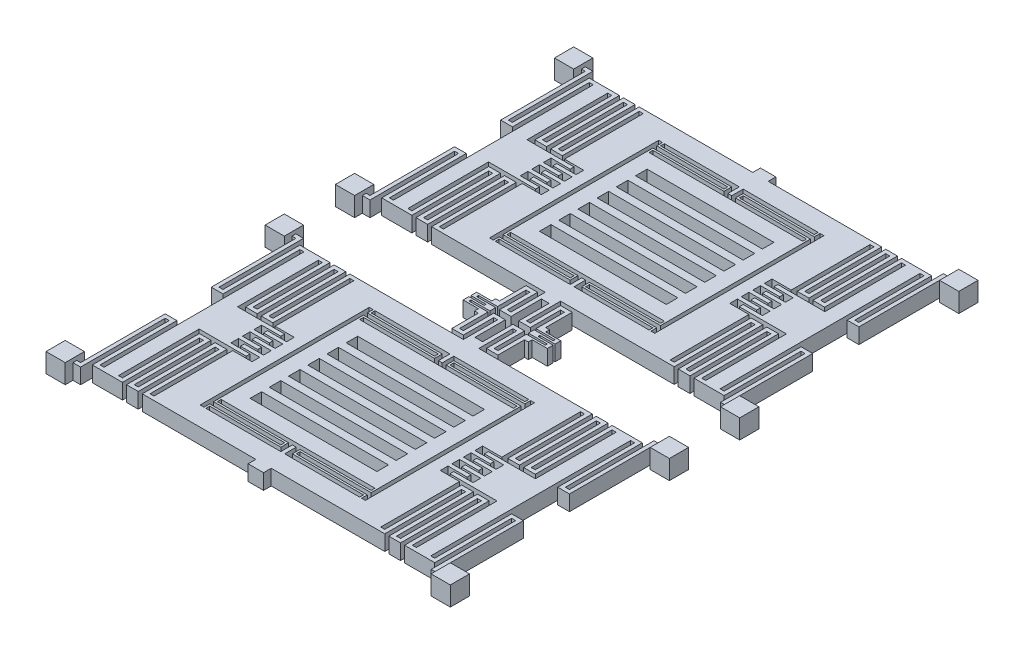
from build123d import *

# Parameters (mm, degrees)
SKETCH1_W           = 0.41
SKETCH1_H           = 0.36
SKETCH1_W_2         = 0.33
SKETCH1_H_2         = 0.03
BOSS_EXTRUDE1_DEPTH = 0.04
BOSS_EXTRUDE2_DEPTH = 0.04
BOSS_EXTRUDE3_DEPTH = 0.04
SKETCH4_W           = 0.05
SKETCH4_H           = 0.05
BOSS_EXTRUDE4_DEPTH = 0.05
BOSS_EXTRUDE5_DEPTH = 0.04


with BuildPart() as part:
    # Sketch1 → Boss-Extrude1 (new body)
    with BuildSketch(Plane(origin=(0, 0, 0), x_dir=(1, 0, 0), z_dir=(0, 1, 0))):
        Rectangle(SKETCH1_W, SKETCH1_H)
        with Locations((0, 0.075)):
            Rectangle(SKETCH1_W_2, SKETCH1_H_2, mode=Mode.SUBTRACT)
        with Locations((0, 0.025)):
            Rectangle(SKETCH1_W_2, SKETCH1_H_2, mode=Mode.SUBTRACT)
        with Locations((0, 0.125)):
            Rectangle(SKETCH1_W_2, SKETCH1_H_2, mode=Mode.SUBTRACT)
        with Locations((0, -0.125)):
            Rectangle(SKETCH1_W_2, SKETCH1_H_2, mode=Mode.SUBTRACT)
        with Locations((0, -0.075)):
            Rectangle(SKETCH1_W_2, SKETCH1_H_2, mode=Mode.SUBTRACT)
        with Locations((0, -0.025)):
            Rectangle(SKETCH1_W_2, SKETCH1_H_2, mode=Mode.SUBTRACT)
    boss_extrude1 = extrude(amount=BOSS_EXTRUDE1_DEPTH)

    # Sketch2 → Boss-Extrude2 (add)
    with BuildSketch(Plane(origin=(0, 0, 0), x_dir=(1, 0, 0), z_dir=(0, 1, 0))):
        Polygon((-0.295, 0.27), (-0.02, 0.27), (-0.02, 0.29), (0.02, 0.29), (0.02, 0.27), (0.295, 0.27), (0.295, 0.055), (0.245, 0.055), (0.245, 0.035), (0.295, 0.035), (0.295, 0.025), (0.245, 0.025), (0.245, 0.005), (0.295, 0.005), (0.295, -0.005), (0.245, -0.005), (0.245, -0.025), (0.295, -0.025), (0.295, -0.035), (0.245, -0.035), (0.245, -0.055), (0.295, -0.055), (0.295, -0.27), (0.02, -0.27), (0.02, -0.29), (-0.02, -0.29), (-0.02, -0.27), (-0.295, -0.27), (-0.295, -0.055), (-0.245, -0.055), (-0.245, -0.035), (-0.295, -0.035), (-0.295, -0.025), (-0.245, -0.025), (-0.245, -0.005), (-0.295, -0.005), (-0.295, 0.005), (-0.245, 0.005), (-0.245, 0.025), (-0.295, 0.025), (-0.295, 0.035), (-0.245, 0.035), (-0.245, 0.055), (-0.295, 0.055), align=None)
        Polygon((-0.215, -0.22), (-0.215, 0.22), (-0.205, 0.22), (-0.205, 0.205), (-0.02, 0.205), (-0.02, 0.195), (-0.205, 0.195), (-0.205, 0.18), (-0.2, 0.18), (-0.2, 0.19), (-0.015, 0.19), (-0.015, 0.21), (-0.2, 0.21), (-0.2, 0.22), (-0.005, 0.22), (-0.005, 0.19), (0.005, 0.19), (0.005, 0.22), (0.2, 0.22), (0.2, 0.21), (0.015, 0.21), (0.015, 0.19), (0.2, 0.19), (0.2, 0.18), (0.205, 0.18), (0.205, 0.195), (0.02, 0.195), (0.02, 0.205), (0.205, 0.205), (0.205, 0.22), (0.215, 0.22), (0.215, -0.22), (0.205, -0.22), (0.205, -0.205), (0.02, -0.205), (0.02, -0.195), (0.205, -0.195), (0.205, -0.18), (0.2, -0.18), (0.2, -0.19), (0.015, -0.19), (0.015, -0.21), (0.2, -0.21), (0.2, -0.22), (0.005, -0.22), (0.005, -0.19), (-0.005, -0.19), (-0.005, -0.22), (-0.2, -0.22), (-0.2, -0.21), (-0.015, -0.21), (-0.015, -0.19), (-0.2, -0.19), (-0.2, -0.18), (-0.205, -0.18), (-0.205, -0.195), (-0.02, -0.195), (-0.02, -0.205), (-0.205, -0.205), (-0.205, -0.22), align=None, mode=Mode.SUBTRACT)
    boss_extrude2 = extrude(amount=BOSS_EXTRUDE2_DEPTH)

    # Sketch3 → Boss-Extrude3 (add)
    with BuildSketch(Plane(origin=(0, 0, 0), x_dir=(1, 0, 0), z_dir=(0, 1, 0))):
        Polygon((-0.315, 0.01), (-0.265, 0.01), (-0.265, 0.02), (-0.315, 0.02), (-0.315, 0.04), (-0.265, 0.04), (-0.265, 0.05), (-0.315, 0.05), (-0.3875, 0.05), (-0.3875, 0.26), (-0.377, 0.26), (-0.377, 0.06), (-0.3465, 0.06), (-0.3465, 0.26), (-0.336, 0.26), (-0.336, 0.06), (-0.3055, 0.06), (-0.3055, 0.26), (-0.295, 0.26), (-0.295, 0.27), (-0.3155, 0.27), (-0.3155, 0.07), (-0.326, 0.07), (-0.326, 0.27), (-0.3565, 0.27), (-0.3565, 0.07), (-0.367, 0.07), (-0.367, 0.27), (-0.3875, 0.27), (-0.425, 0.27), (-0.4455, 0.27), (-0.4455, 0.07), (-0.456, 0.07), (-0.456, 0.27), (-0.456, 0.29), (-0.476, 0.29), (-0.476, 0.28), (-0.466, 0.28), (-0.466, 0.26), (-0.466, 0.06), (-0.4355, 0.06), (-0.4355, 0.26), (-0.425, 0.26), (-0.425, 0.05), (-0.425, -0.05), (-0.425, -0.26), (-0.4355, -0.26), (-0.4355, -0.06), (-0.466, -0.06), (-0.466, -0.26), (-0.466, -0.28), (-0.476, -0.28), (-0.476, -0.29), (-0.456, -0.29), (-0.456, -0.27), (-0.456, -0.07), (-0.4455, -0.07), (-0.4455, -0.27), (-0.425, -0.27), (-0.3875, -0.27), (-0.367, -0.27), (-0.367, -0.07), (-0.3565, -0.07), (-0.3565, -0.27), (-0.326, -0.27), (-0.326, -0.07), (-0.3155, -0.07), (-0.3155, -0.27), (-0.295, -0.27), (-0.295, -0.26), (-0.3055, -0.26), (-0.3055, -0.06), (-0.336, -0.06), (-0.336, -0.26), (-0.3465, -0.26), (-0.3465, -0.06), (-0.377, -0.06), (-0.377, -0.26), (-0.3875, -0.26), (-0.3875, -0.05), (-0.315, -0.05), (-0.265, -0.05), (-0.265, -0.04), (-0.315, -0.04), (-0.315, -0.02), (-0.265, -0.02), (-0.265, -0.01), (-0.315, -0.01), align=None)
        Polygon((0.425, 0.05), (0.425, -0.05), (0.425, -0.26), (0.4355, -0.26), (0.4355, -0.06), (0.466, -0.06), (0.466, -0.26), (0.466, -0.28), (0.476, -0.28), (0.476, -0.29), (0.456, -0.29), (0.456, -0.27), (0.456, -0.07), (0.4455, -0.07), (0.4455, -0.27), (0.425, -0.27), (0.3875, -0.27), (0.367, -0.27), (0.367, -0.07), (0.3565, -0.07), (0.3565, -0.27), (0.326, -0.27), (0.326, -0.07), (0.3155, -0.07), (0.3155, -0.27), (0.295, -0.27), (0.295, -0.26), (0.3055, -0.26), (0.3055, -0.06), (0.336, -0.06), (0.336, -0.26), (0.3465, -0.26), (0.3465, -0.06), (0.377, -0.06), (0.377, -0.26), (0.3875, -0.26), (0.3875, -0.05), (0.315, -0.05), (0.265, -0.05), (0.265, -0.04), (0.315, -0.04), (0.315, -0.02), (0.265, -0.02), (0.265, -0.01), (0.315, -0.01), (0.315, 0.01), (0.265, 0.01), (0.265, 0.02), (0.315, 0.02), (0.315, 0.04), (0.265, 0.04), (0.265, 0.05), (0.315, 0.05), (0.3875, 0.05), (0.3875, 0.26), (0.377, 0.26), (0.377, 0.06), (0.3465, 0.06), (0.3465, 0.26), (0.336, 0.26), (0.336, 0.06), (0.3055, 0.06), (0.3055, 0.26), (0.295, 0.26), (0.295, 0.27), (0.3155, 0.27), (0.3155, 0.07), (0.326, 0.07), (0.326, 0.27), (0.3565, 0.27), (0.3565, 0.07), (0.367, 0.07), (0.367, 0.27), (0.3875, 0.27), (0.425, 0.27), (0.4455, 0.27), (0.4455, 0.07), (0.456, 0.07), (0.456, 0.27), (0.456, 0.29), (0.476, 0.29), (0.476, 0.28), (0.466, 0.28), (0.466, 0.26), (0.466, 0.06), (0.4355, 0.06), (0.4355, 0.26), (0.425, 0.26), align=None)
    boss_extrude3 = extrude(amount=BOSS_EXTRUDE3_DEPTH)

    # Sketch4 → Boss-Extrude4 (add)
    with BuildSketch(Plane(origin=(0, 0, 0), x_dir=(1, 0, 0), z_dir=(0, 1, 0))):
        with Locations((-0.501, -0.285)):
            Rectangle(SKETCH4_W, SKETCH4_H)
        with Locations((-0.501, 0.285)):
            Rectangle(SKETCH4_W, SKETCH4_H)
        with Locations((0.501, -0.285)):
            Rectangle(SKETCH4_W, SKETCH4_H)
        with Locations((0.501, 0.285)):
            Rectangle(SKETCH4_W, SKETCH4_H)
    boss_extrude4 = extrude(amount=BOSS_EXTRUDE4_DEPTH)

    # Sketch5 → Boss-Extrude5 (add)
    with BuildSketch(Plane(origin=(0, 0, 0), x_dir=(1, 0, 0), z_dir=(0, 1, 0))):
        Polygon((-0.06, -0.28), (-0.06, -0.349), (-0.07, -0.349), (-0.07, -0.359), (-0.1095, -0.359), (-0.1095, -0.374), (-0.07, -0.374), (-0.07, -0.379), (-0.1095, -0.379), (-0.1095, -0.394), (-0.07, -0.394), (-0.07, -0.404), (-0.06, -0.404), (-0.06, -0.473), (-0.03, -0.473), (-0.03, -0.394), (-0.02, -0.394), (-0.02, -0.463), (-0.01, -0.463), (-0.01, -0.384), (-0.04, -0.384), (-0.04, -0.463), (-0.05, -0.463), (-0.05, -0.389), (-0.0995, -0.389), (-0.0995, -0.384), (-0.05, -0.384), (-0.05, -0.3765), (-0.05, -0.369), (-0.0995, -0.369), (-0.0995, -0.364), (-0.05, -0.364), (-0.05, -0.29), (-0.04, -0.29), (-0.04, -0.369), (-0.01, -0.369), (-0.01, -0.29), (-0.02, -0.29), (-0.02, -0.359), (-0.03, -0.359), (-0.03, -0.28), align=None)
        Polygon((0.06, -0.473), (0.06, -0.404), (0.07, -0.404), (0.07, -0.394), (0.1095, -0.394), (0.1095, -0.379), (0.07, -0.379), (0.07, -0.374), (0.1095, -0.374), (0.1095, -0.359), (0.07, -0.359), (0.07, -0.349), (0.06, -0.349), (0.06, -0.28), (0.03, -0.28), (0.03, -0.359), (0.02, -0.359), (0.02, -0.29), (0.01, -0.29), (0.01, -0.369), (0.04, -0.369), (0.04, -0.29), (0.05, -0.29), (0.05, -0.364), (0.0995, -0.364), (0.0995, -0.369), (0.05, -0.369), (0.05, -0.3765), (0.05, -0.384), (0.0995, -0.384), (0.0995, -0.389), (0.05, -0.389), (0.05, -0.463), (0.04, -0.463), (0.04, -0.384), (0.01, -0.384), (0.01, -0.463), (0.02, -0.463), (0.02, -0.394), (0.03, -0.394), (0.03, -0.473), align=None)
    extrude(amount=BOSS_EXTRUDE5_DEPTH)

    # Mirror1: Boss-Extrude2, Boss-Extrude3, Boss-Extrude4 across plane
    add(boss_extrude2.mirror(Plane.XY.offset(0.3765)))
    add(boss_extrude3.mirror(Plane.XY.offset(0.3765)))
    add(boss_extrude4.mirror(Plane.XY.offset(0.3765)))

    # Mirror2: Boss-Extrude1 across plane
    add(boss_extrude1.mirror(Plane.XY.offset(0.3765)))


solid = part.part
